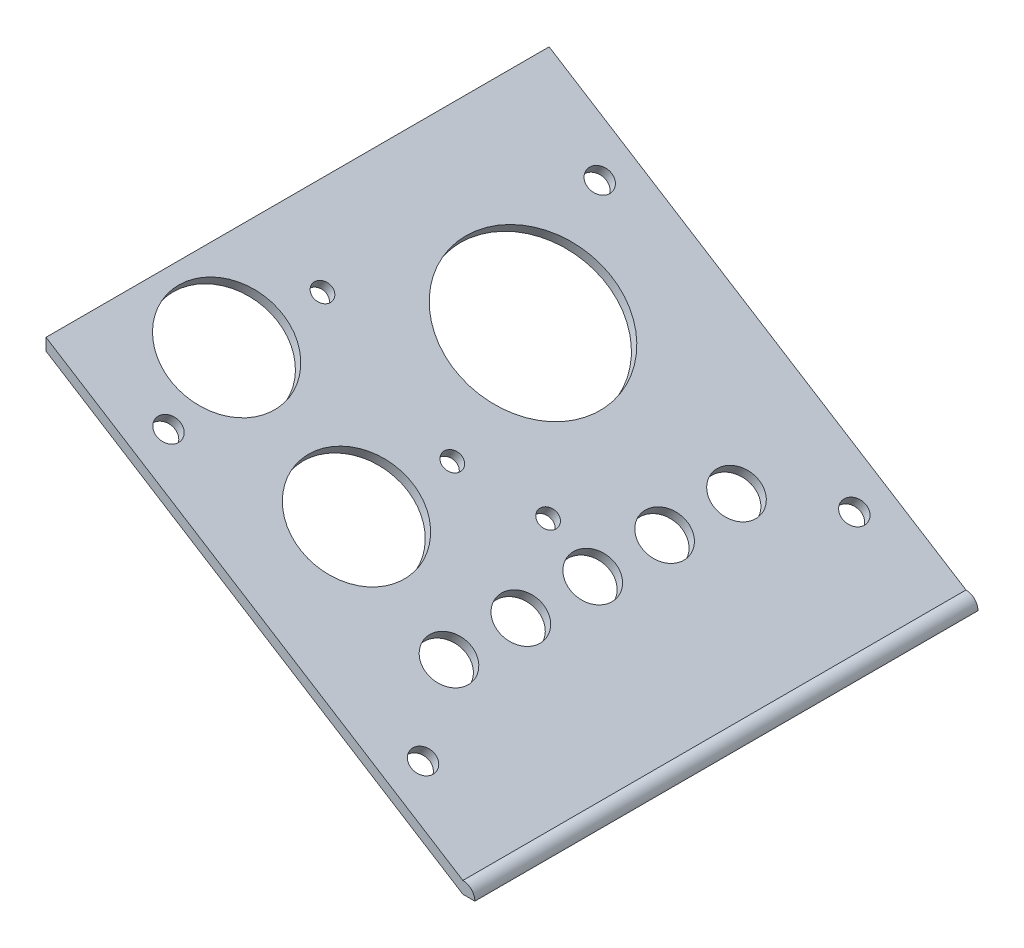
from build123d import *

# Parameters (mm, degrees)
BOSS_EXTRUDE1_DEPTH = 133.35
SKETCH2_R           = 21
CUT_EXTRUDE1_DEPTH  = 187.593999065
SKETCH3_W           = 133.35
SKETCH3_H           = 3.175
BOSS_EXTRUDE2_DEPTH = 3.175
FILLET1_R           = 3.175
SKETCH5_R           = 15
CUT_EXTRUDE2_DEPTH  = 189.467318942
SKETCH6_R           = 6.0325
CUT_EXTRUDE3_DEPTH  = 189.467318942
SKETCH7_R           = 3.175
CUT_EXTRUDE4_DEPTH  = 189.472240296
SKETCH15_R          = 2.5
CUT_EXTRUDE8_DEPTH  = 189.467318942
SKETCH18_R          = 30.1625
SKETCH18_R_2        = 21
BOSS_EXTRUDE3_DEPTH = 2.688354466


with BuildPart() as part:
    # Sketch1 → Boss-Extrude1 (new body)
    with BuildSketch(Plane.XY):
        Polygon((110.49, -69.425000088), (0, 0), (0, 3.175), (110.49, -66.250000088), align=None)
    extrude(amount=BOSS_EXTRUDE1_DEPTH)

    # Sketch2 → Cut-Extrude1 (cut, through all)
    with BuildSketch(Plane(origin=(1.430283892, 2.276299128, 0), x_dir=(0.8467258159330607, -0.5320295035357462, 0), z_dir=(0.5320295035357462, 0.8467258159330607, 0))):
        with Locations(Location((42.760806326, -41.91, 0), (0, 0, 180))):
            Circle(SKETCH2_R)
    extrude(amount=-CUT_EXTRUDE1_DEPTH, mode=Mode.SUBTRACT)

    # Sketch3 → Boss-Extrude2 (add)
    with BuildSketch(Plane(origin=(110.49, 0, 0), x_dir=(0, 0, -1), z_dir=(1, 0, 0))):
        with Locations((-66.675, -67.837500088)):
            Rectangle(SKETCH3_W, SKETCH3_H)
    extrude(amount=BOSS_EXTRUDE2_DEPTH)

    # Fillet1
    fillet1_edges = [part.edges().sort_by_distance(p)[0] for p in [
        (113.665, -66.250000088, 66.675),
    ]]
    fillet(fillet1_edges, radius=FILLET1_R - 0.0001)  # a hair under: the kernel refuses the full size

    # Sketch5 → Cut-Extrude2 (cut, through all)
    with BuildSketch(Plane(origin=(1.430283892, 2.276299128, 0), x_dir=(0.8467258159330606, -0.5320295035357464, 0), z_dir=(0.5320295035357464, 0.8467258159330606, 0))):
        with Locations(Location((17.360806326, -101.6, 0), (0, 0, 180))):
            Circle(SKETCH5_R)
        with Locations(Location((58.000806326, -101.6, 0), (0, 0, 180))):
            Circle(SKETCH5_R)
    extrude(amount=-CUT_EXTRUDE2_DEPTH, mode=Mode.SUBTRACT)

    # Sketch6 → Cut-Extrude3 (cut, through all)
    with BuildSketch(Plane(origin=(1.430283892, 2.276299128, 0), x_dir=(0.8467258159330606, -0.5320295035357464, 0), z_dir=(0.5320295035357464, 0.8467258159330606, 0))):
        with Locations(Location((90.701690059, -66.675, 0), (0, 0, 180))):
            Circle(SKETCH6_R)
        with Locations(Location((90.701690059, -47.625, 0), (0, 0, 180))):
            Circle(SKETCH6_R)
        with Locations(Location((90.701690059, -28.575, 0), (0, 0, 180))):
            Circle(SKETCH6_R)
        with Locations(Location((90.701690059, -85.725, 0), (0, 0, 180))):
            Circle(SKETCH6_R)
        with Locations(Location((90.701690059, -104.775, 0), (0, 0, 180))):
            Circle(SKETCH6_R)
    extrude(amount=-CUT_EXTRUDE3_DEPTH, mode=Mode.SUBTRACT)

    # Sketch7 → Cut-Extrude4 (cut, through all)
    with BuildSketch(Plane(origin=(0, 0, 0), x_dir=(0.8467258159330607, -0.5320295035357464, 0), z_dir=(-0.5320295035357463, -0.8467258159330606, 0))):
        with Locations((105.090883732, 123.825)):
            Circle(SKETCH7_R)
        with Locations((25.4, 123.825)):
            Circle(SKETCH7_R)
        with Locations((25.4, 9.525)):
            Circle(SKETCH7_R)
        with Locations((105.090883732, 9.525)):
            Circle(SKETCH7_R)
    extrude(amount=-CUT_EXTRUDE4_DEPTH, mode=Mode.SUBTRACT)

    # Sketch15 → Cut-Extrude8 (cut, through all)
    with BuildSketch(Plane(origin=(1.430283892, 2.276299128, 0), x_dir=(0.8467258159330606, -0.5320295035357464, 0), z_dir=(0.5320295035357464, 0.8467258159330606, 0))):
        with Locations(Location((17.360806326, -76.2, 0), (0, 0, 180))):
            Circle(SKETCH15_R)
        with Locations(Location((76.731690059, -66.675, 0), (0, 0, 180))):
            Circle(SKETCH15_R)
        with Locations(Location((58.000806326, -76.2, 0), (0, 0, 180))):
            Circle(SKETCH15_R)
    extrude(amount=-CUT_EXTRUDE8_DEPTH, mode=Mode.SUBTRACT)

    # Sketch18 → Boss-Extrude3 (add)
    with BuildSketch(Plane(origin=(1.430283892, 2.276299128, 0), x_dir=(0.8467258159330606, -0.5320295035357464, 0), z_dir=(0.5320295035357464, 0.8467258159330606, 0))):
        with Locations((42.760806326, -41.91)):
            Circle(SKETCH18_R)
        with Locations(Location((42.760806326, -41.91, 0), (0, 0, 180))):
            Circle(SKETCH18_R_2, mode=Mode.SUBTRACT)
    extrude(amount=-BOSS_EXTRUDE3_DEPTH)


solid = part.part
